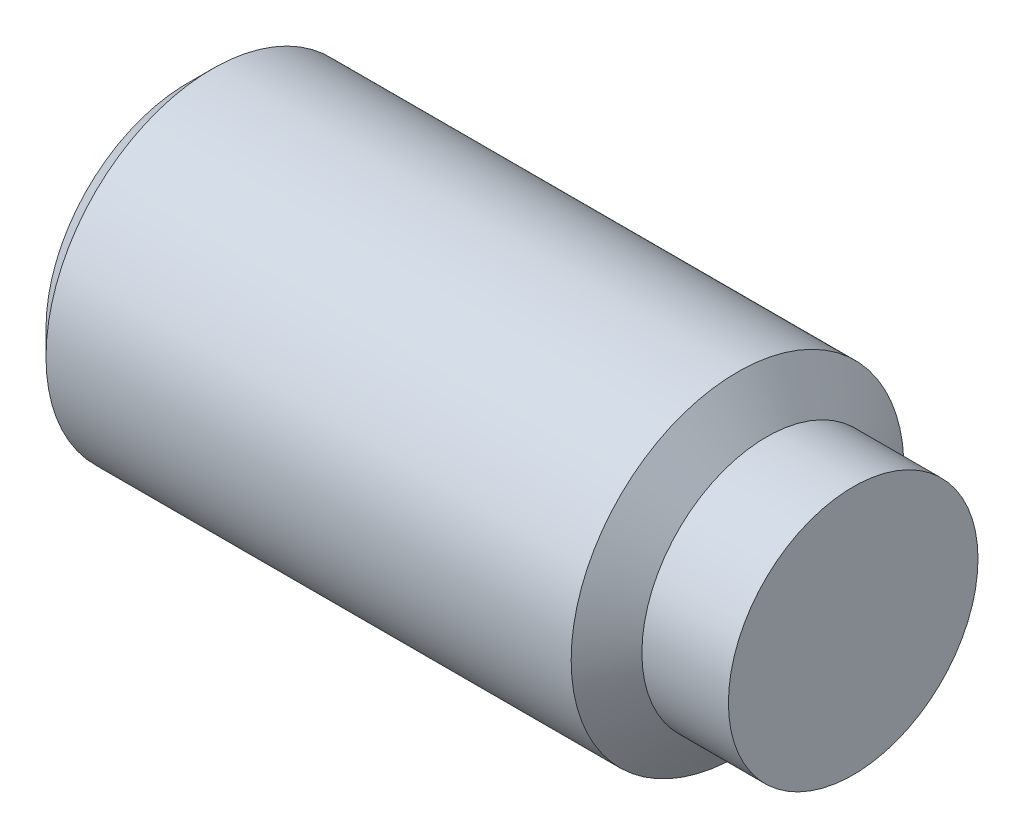
from build123d import *

# Parameters (mm, degrees)
HEX_2_DEPTH = 14.2748


with BuildPart() as part:
    # BodySke → BaseBody (revolve)
    with BuildSketch(Plane.XY):
        Polygon((0, 0), (0, 10.81024), (1.88976, 12.7), (41.972841066, 12.7), (44.196, 9.525), (50.8, 9.525), (50.8, 0), align=None)
    revolve(axis=Axis((-12.7, 0, 0), (1, 0, 0)))

    # Sketch2 → Hex 2 (cut)
    with BuildSketch(Plane.ZY):
        Polygon((4.120779811, 7.1374), (-4.120779811, 7.1374), (-8.241559623, 0), (-4.120779811, -7.1374), (4.120779811, -7.1374), (8.241559623, 0), align=None)
    extrude(amount=-HEX_2_DEPTH, mode=Mode.SUBTRACT)


solid = part.part
